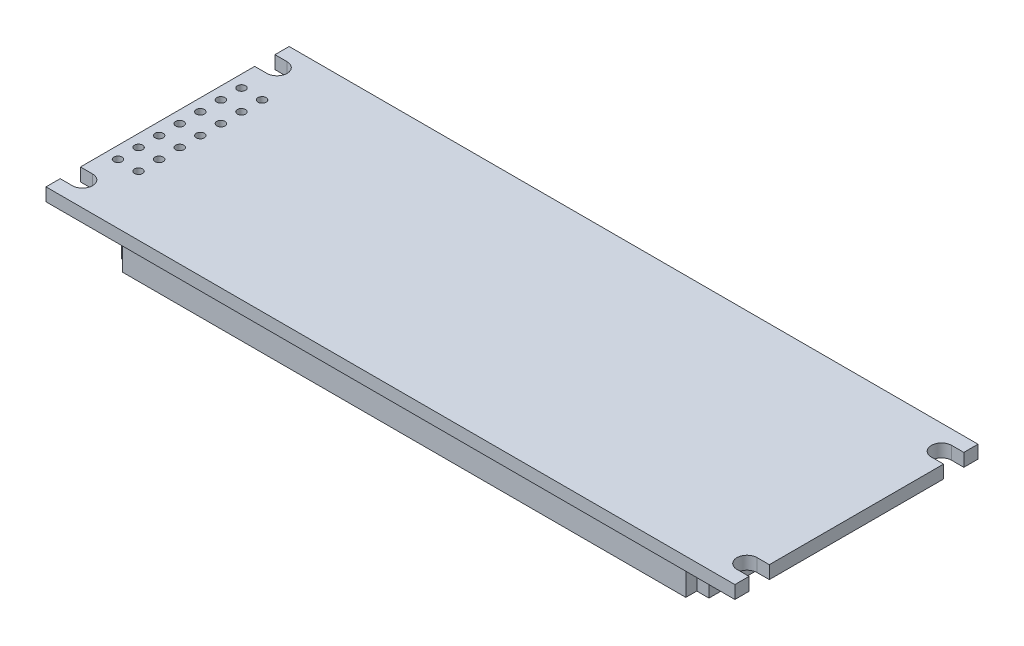
from build123d import *

# Parameters (mm, degrees)
BOSS_EXTRU_1_DEPTH      = 1.6
ESQUISSE2_R             = 0.5
ENL_V_MAT_EXTRU_1_DEPTH = 46.097782651
BOSS_EXTRU_2_DEPTH      = 4.5
ESQUISSE5_W             = 62
ESQUISSE5_H             = 16
ENL_V_MAT_EXTRU_2_DEPTH = 0.2
ESQUISSE6_W             = 2.78
ESQUISSE6_H             = 4.89
ENL_V_MAT_EXTRU_3_DEPTH = 0.1


with BuildPart() as part:
    # Esquisse1 → Boss.-Extru.1 (new body)
    with BuildSketch(Plane(origin=(0, 0, 0), x_dir=(1, 0, 0), z_dir=(0, 1, 0))):
        with BuildLine():
            ThreePointArc((-41, -10.75), (-39.75, -12), (-41, -13.25))
            Line((-41, -13.25), (-42.5, -13.25))
            Line((-42.5, -13.25), (-42.5, -15))
            Line((-42.5, -15), (42.5, -15))
            Line((42.5, -15), (42.5, -13.25))
            Line((42.5, -13.25), (41, -13.25))
            ThreePointArc((41, -13.25), (39.75, -12), (41, -10.75))
            Line((41, -10.75), (42.5, -10.75))
            Line((42.5, -10.75), (42.5, 10.75))
            Line((42.5, 10.75), (41, 10.75))
            ThreePointArc((41, 10.75), (39.75, 12), (41, 13.25))
            Line((41, 13.25), (42.5, 13.25))
            Line((42.5, 13.25), (42.5, 15))
            Line((42.5, 15), (-42.5, 15))
            Line((-42.5, 15), (-42.5, 13.25))
            Line((-42.5, 13.25), (-41, 13.25))
            ThreePointArc((-41, 13.25), (-39.75, 12), (-41, 10.75))
            Line((-41, 10.75), (-42.5, 10.75))
            Line((-42.5, 10.75), (-42.5, -10.75))
            Line((-42.5, -10.75), (-41, -10.75))
        make_face()
    extrude(amount=BOSS_EXTRU_1_DEPTH)

    # Esquisse2 → Enlèv. mat.-Extru.1 (cut, through all)
    with BuildSketch(Plane.XZ):
        with Locations((-41, 7.62)):
            Circle(ESQUISSE2_R)
        with Locations((-38.46, 7.62)):
            Circle(ESQUISSE2_R)
        with Locations((-38.46, 5.08)):
            Circle(ESQUISSE2_R)
        with Locations((-38.46, 2.54)):
            Circle(ESQUISSE2_R)
        with Locations((-38.46, 0)):
            Circle(ESQUISSE2_R)
        with Locations((-38.46, -2.54)):
            Circle(ESQUISSE2_R)
        with Locations((-38.46, -5.08)):
            Circle(ESQUISSE2_R)
        with Locations((-38.46, -7.62)):
            Circle(ESQUISSE2_R)
        with Locations((-41, 5.08)):
            Circle(ESQUISSE2_R)
        with Locations((-41, 2.54)):
            Circle(ESQUISSE2_R)
        with Locations((-41, 0)):
            Circle(ESQUISSE2_R)
        with Locations((-41, -2.54)):
            Circle(ESQUISSE2_R)
        with Locations((-41, -5.08)):
            Circle(ESQUISSE2_R)
        with Locations((-41, -7.62)):
            Circle(ESQUISSE2_R)
    extrude(amount=-ENL_V_MAT_EXTRU_1_DEPTH, mode=Mode.SUBTRACT)

    # Esquisse3 → Boss.-Extru.2 (add)
    with BuildSketch(Plane.XZ):
        Polygon((-34.75, 13.3), (-34.75, 11.95), (-36.25, 11.95), (-36.25, -11.95), (-34.75, -11.95), (-34.75, -13.3), (34.75, -13.3), (34.75, -11.95), (36.25, -11.95), (36.25, 11.95), (34.75, 11.95), (34.75, 13.3), align=None)
    extrude(amount=BOSS_EXTRU_2_DEPTH)

    # Esquisse5 → Enlèv. mat.-Extru.2 (cut)
    with BuildSketch(Plane.XZ.offset(4.5)):
        Rectangle(ESQUISSE5_W, ESQUISSE5_H)
    extrude(amount=-ENL_V_MAT_EXTRU_2_DEPTH, mode=Mode.SUBTRACT)

    # Esquisse6 → Enlèv. mat.-Extru.3 (cut)
    with BuildSketch(Plane.XZ.offset(4.3)):
        with Locations((26.475, -3.045)):
            Rectangle(ESQUISSE6_W, ESQUISSE6_H)
        with Locations((22.995, -3.045)):
            Rectangle(ESQUISSE6_W, ESQUISSE6_H)
        with Locations((19.515, -3.045)):
            Rectangle(ESQUISSE6_W, ESQUISSE6_H)
        with Locations((16.035, -3.045)):
            Rectangle(ESQUISSE6_W, ESQUISSE6_H)
        with Locations((12.555, -3.045)):
            Rectangle(ESQUISSE6_W, ESQUISSE6_H)
        with Locations((9.075, -3.045)):
            Rectangle(ESQUISSE6_W, ESQUISSE6_H)
        with Locations((5.595, -3.045)):
            Rectangle(ESQUISSE6_W, ESQUISSE6_H)
        with Locations((2.115, -3.045)):
            Rectangle(ESQUISSE6_W, ESQUISSE6_H)
        with Locations((-1.365, -3.045)):
            Rectangle(ESQUISSE6_W, ESQUISSE6_H)
        with Locations((-4.845, -3.045)):
            Rectangle(ESQUISSE6_W, ESQUISSE6_H)
        with Locations((-8.325, -3.045)):
            Rectangle(ESQUISSE6_W, ESQUISSE6_H)
        with Locations((-11.805, -3.045)):
            Rectangle(ESQUISSE6_W, ESQUISSE6_H)
        with Locations((-15.285, -3.045)):
            Rectangle(ESQUISSE6_W, ESQUISSE6_H)
        with Locations((-18.765, -3.045)):
            Rectangle(ESQUISSE6_W, ESQUISSE6_H)
        with Locations((-22.245, -3.045)):
            Rectangle(ESQUISSE6_W, ESQUISSE6_H)
        with Locations((-25.725, -3.045)):
            Rectangle(ESQUISSE6_W, ESQUISSE6_H)
        with Locations((26.475, 2.955)):
            Rectangle(ESQUISSE6_W, ESQUISSE6_H)
        with Locations((22.995, 2.955)):
            Rectangle(ESQUISSE6_W, ESQUISSE6_H)
        with Locations((19.515, 2.955)):
            Rectangle(ESQUISSE6_W, ESQUISSE6_H)
        with Locations((16.035, 2.955)):
            Rectangle(ESQUISSE6_W, ESQUISSE6_H)
        with Locations((12.555, 2.955)):
            Rectangle(ESQUISSE6_W, ESQUISSE6_H)
        with Locations((9.075, 2.955)):
            Rectangle(ESQUISSE6_W, ESQUISSE6_H)
        with Locations((5.595, 2.955)):
            Rectangle(ESQUISSE6_W, ESQUISSE6_H)
        with Locations((2.115, 2.955)):
            Rectangle(ESQUISSE6_W, ESQUISSE6_H)
        with Locations((-1.365, 2.955)):
            Rectangle(ESQUISSE6_W, ESQUISSE6_H)
        with Locations((-4.845, 2.955)):
            Rectangle(ESQUISSE6_W, ESQUISSE6_H)
        with Locations((-8.325, 2.955)):
            Rectangle(ESQUISSE6_W, ESQUISSE6_H)
        with Locations((-11.805, 2.955)):
            Rectangle(ESQUISSE6_W, ESQUISSE6_H)
        with Locations((-15.285, 2.955)):
            Rectangle(ESQUISSE6_W, ESQUISSE6_H)
        with Locations((-18.765, 2.955)):
            Rectangle(ESQUISSE6_W, ESQUISSE6_H)
        with Locations((-22.245, 2.955)):
            Rectangle(ESQUISSE6_W, ESQUISSE6_H)
        with Locations((-25.725, 2.955)):
            Rectangle(ESQUISSE6_W, ESQUISSE6_H)
    extrude(amount=-ENL_V_MAT_EXTRU_3_DEPTH, mode=Mode.SUBTRACT)


solid = part.part
